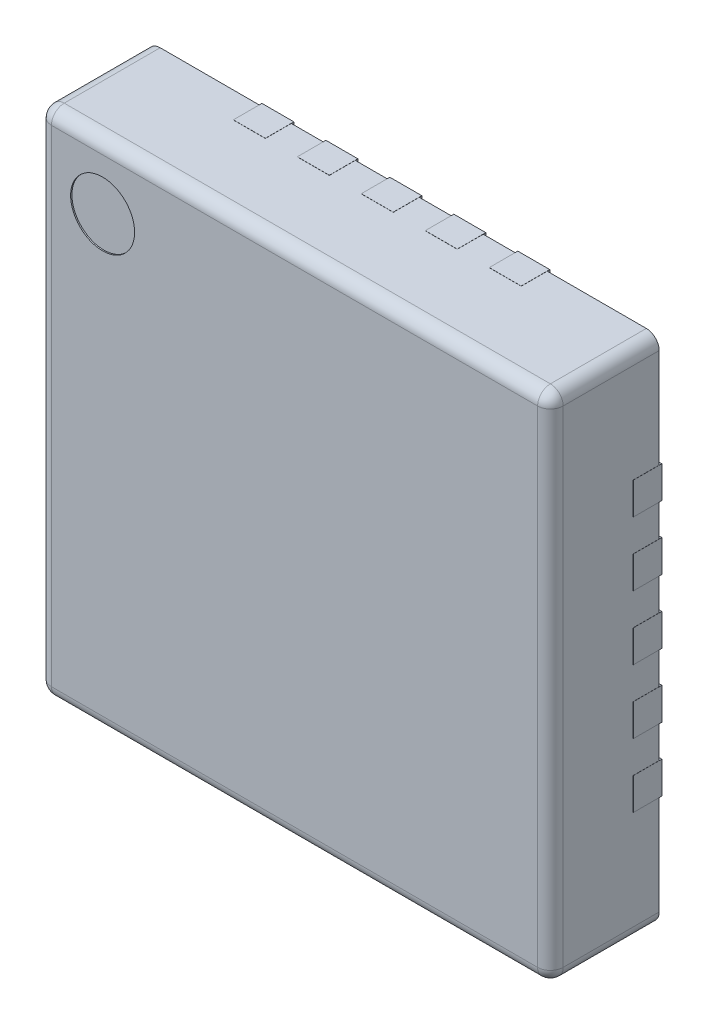
from build123d import *

# Parameters (mm, degrees)
SKETCH1_W                   = 4
SKETCH1_H                   = 4
BOSS_EXTRUDE1_DEPTH         = 0.85
FILLET1_R                   = 0.1
BOSS_EXTRUDE2_DEPTH         = 0.02
BOSS_EXTRUDE2_DEPTH_BACK    = 0.203
BOSS_EXTRUDE2_2_DEPTH       = 0.02
BOSS_EXTRUDE2_2_DEPTH_BACK  = 0.203
BOSS_EXTRUDE2_3_DEPTH       = 0.02
BOSS_EXTRUDE2_3_DEPTH_BACK  = 0.203
BOSS_EXTRUDE2_4_DEPTH       = 0.02
BOSS_EXTRUDE2_4_DEPTH_BACK  = 0.203
BOSS_EXTRUDE2_5_DEPTH       = 0.02
BOSS_EXTRUDE2_5_DEPTH_BACK  = 0.203
BOSS_EXTRUDE2_6_DEPTH       = 0.02
BOSS_EXTRUDE2_6_DEPTH_BACK  = 0.203
BOSS_EXTRUDE2_7_DEPTH       = 0.02
BOSS_EXTRUDE2_7_DEPTH_BACK  = 0.203
BOSS_EXTRUDE2_8_DEPTH       = 0.02
BOSS_EXTRUDE2_8_DEPTH_BACK  = 0.203
BOSS_EXTRUDE2_9_DEPTH       = 0.02
BOSS_EXTRUDE2_9_DEPTH_BACK  = 0.203
BOSS_EXTRUDE2_10_DEPTH      = 0.02
BOSS_EXTRUDE2_10_DEPTH_BACK = 0.203
BOSS_EXTRUDE2_11_DEPTH      = 0.02
BOSS_EXTRUDE2_11_DEPTH_BACK = 0.203
BOSS_EXTRUDE2_12_DEPTH      = 0.02
BOSS_EXTRUDE2_12_DEPTH_BACK = 0.203
BOSS_EXTRUDE2_13_DEPTH      = 0.02
BOSS_EXTRUDE2_13_DEPTH_BACK = 0.203
BOSS_EXTRUDE2_14_DEPTH      = 0.02
BOSS_EXTRUDE2_14_DEPTH_BACK = 0.203
BOSS_EXTRUDE2_15_DEPTH      = 0.02
BOSS_EXTRUDE2_15_DEPTH_BACK = 0.203
BOSS_EXTRUDE2_16_DEPTH      = 0.02
BOSS_EXTRUDE2_16_DEPTH_BACK = 0.203
BOSS_EXTRUDE2_17_DEPTH      = 0.02
BOSS_EXTRUDE2_17_DEPTH_BACK = 0.203
BOSS_EXTRUDE2_18_DEPTH      = 0.02
BOSS_EXTRUDE2_18_DEPTH_BACK = 0.203
BOSS_EXTRUDE2_19_DEPTH      = 0.02
BOSS_EXTRUDE2_19_DEPTH_BACK = 0.203
BOSS_EXTRUDE2_20_DEPTH      = 0.02
BOSS_EXTRUDE2_20_DEPTH_BACK = 0.203
BOSS_EXTRUDE2_21_DEPTH      = 0.02
BOSS_EXTRUDE2_21_DEPTH_BACK = 0.203
SKETCH3_R                   = 0.25
CUT_EXTRUDE1_DEPTH          = 0.01


with BuildPart() as part:
    # Sketch1 → Boss-Extrude1 (new body)
    with BuildSketch(Plane.XY):
        Rectangle(SKETCH1_W, SKETCH1_H)
    extrude(amount=BOSS_EXTRUDE1_DEPTH)

    # Fillet1
    fillet1_edges = [part.edges().sort_by_distance(p)[0] for p in [
        (-2, -2, 0.425),
        (-2, 0, 0.85),
        (0, -2, 0.85),
        (2, -2, 0.425),
        (2, 0, 0.85),
        (0, 2, 0.85),
        (-2, 2, 0.425),
        (2, 2, 0.425),
    ]]
    fillet(fillet1_edges, radius=FILLET1_R)

    # Sketch3 → Cut-Extrude1 (cut)
    with BuildSketch(Plane.XY.offset(0.85)):
        with Locations((-1.5, 1.5)):
            Circle(SKETCH3_R)
    extrude(amount=-CUT_EXTRUDE1_DEPTH, mode=Mode.SUBTRACT)


with BuildPart() as body_2:
    # Sketch2 → Boss-Extrude2 (new, two sides: drawn at the far end of the back side and taken through both)
    with BuildSketch(Plane(origin=(0, 0, 0), x_dir=(-1, 0, 0), z_dir=(0, 0, -1)).offset(-BOSS_EXTRUDE2_DEPTH_BACK)):
        with BuildLine():
            Line((1.263388348, 1.036611652), (1.036611652, 1.263388348))
            ThreePointArc((1.036611652, 1.263388348), (0.996058734, 1.290484942), (0.948223305, 1.3))
            Line((0.948223305, 1.3), (-1.175, 1.3))
            ThreePointArc((-1.175, 1.3), (-1.263388348, 1.263388348), (-1.3, 1.175))
            Line((-1.3, 1.175), (-1.3, -1.175))
            ThreePointArc((-1.3, -1.175), (-1.263388348, -1.263388348), (-1.175, -1.3))
            Line((-1.175, -1.3), (1.175, -1.3))
            ThreePointArc((1.175, -1.3), (1.263388348, -1.263388348), (1.3, -1.175))
            Line((1.3, -1.175), (1.3, 0.948223305))
            ThreePointArc((1.3, 0.948223305), (1.290484942, 0.996058734), (1.263388348, 1.036611652))
        make_face()
    extrude(amount=BOSS_EXTRUDE2_DEPTH + BOSS_EXTRUDE2_DEPTH_BACK)


with BuildPart() as body_3:
    # Sketch2 → Boss-Extrude2 2 (new, two sides: drawn at the far end of the back side and taken through both)
    with BuildSketch(Plane(origin=(0, 0, 0), x_dir=(-1, 0, 0), z_dir=(0, 0, -1)).offset(-BOSS_EXTRUDE2_2_DEPTH_BACK)):
        with BuildLine():
            Line((-0.125, 2.001), (0.125, 2.001))
            Line((0.125, 2.001), (0.125, 1.726))
            ThreePointArc((0.125, 1.726), (0, 1.601), (-0.125, 1.726))
            Line((-0.125, 1.726), (-0.125, 2.001))
        make_face()
    extrude(amount=BOSS_EXTRUDE2_2_DEPTH + BOSS_EXTRUDE2_2_DEPTH_BACK)


with BuildPart() as body_4:
    # Sketch2 → Boss-Extrude2 3 (new, two sides: drawn at the far end of the back side and taken through both)
    with BuildSketch(Plane(origin=(0, 0, 0), x_dir=(-1, 0, 0), z_dir=(0, 0, -1)).offset(-BOSS_EXTRUDE2_3_DEPTH_BACK)):
        with BuildLine():
            Line((-0.375, 2.001), (-0.375, 1.726))
            ThreePointArc((-0.375, 1.726), (-0.5, 1.601), (-0.625, 1.726))
            Line((-0.625, 1.726), (-0.625, 2.001))
            Line((-0.625, 2.001), (-0.375, 2.001))
        make_face()
    extrude(amount=BOSS_EXTRUDE2_3_DEPTH + BOSS_EXTRUDE2_3_DEPTH_BACK)


with BuildPart() as body_5:
    # Sketch2 → Boss-Extrude2 4 (new, two sides: drawn at the far end of the back side and taken through both)
    with BuildSketch(Plane(origin=(0, 0, 0), x_dir=(-1, 0, 0), z_dir=(0, 0, -1)).offset(-BOSS_EXTRUDE2_4_DEPTH_BACK)):
        with BuildLine():
            Line((-0.875, 2.001), (-0.875, 1.726))
            ThreePointArc((-0.875, 1.726), (-1, 1.601), (-1.125, 1.726))
            Line((-1.125, 1.726), (-1.125, 2.001))
            Line((-1.125, 2.001), (-0.875, 2.001))
        make_face()
    extrude(amount=BOSS_EXTRUDE2_4_DEPTH + BOSS_EXTRUDE2_4_DEPTH_BACK)


with BuildPart() as body_6:
    # Sketch2 → Boss-Extrude2 5 (new, two sides: drawn at the far end of the back side and taken through both)
    with BuildSketch(Plane(origin=(0, 0, 0), x_dir=(-1, 0, 0), z_dir=(0, 0, -1)).offset(-BOSS_EXTRUDE2_5_DEPTH_BACK)):
        with BuildLine():
            Line((1.125, 2.001), (0.875, 2.001))
            Line((0.875, 2.001), (0.875, 1.726))
            ThreePointArc((0.875, 1.726), (1, 1.601), (1.125, 1.726))
            Line((1.125, 1.726), (1.125, 2.001))
        make_face()
    extrude(amount=BOSS_EXTRUDE2_5_DEPTH + BOSS_EXTRUDE2_5_DEPTH_BACK)


with BuildPart() as body_7:
    # Sketch2 → Boss-Extrude2 6 (new, two sides: drawn at the far end of the back side and taken through both)
    with BuildSketch(Plane(origin=(0, 0, 0), x_dir=(-1, 0, 0), z_dir=(0, 0, -1)).offset(-BOSS_EXTRUDE2_6_DEPTH_BACK)):
        with BuildLine():
            Line((0.625, 2.001), (0.375, 2.001))
            Line((0.375, 2.001), (0.375, 1.726))
            ThreePointArc((0.375, 1.726), (0.5, 1.601), (0.625, 1.726))
            Line((0.625, 1.726), (0.625, 2.001))
        make_face()
    extrude(amount=BOSS_EXTRUDE2_6_DEPTH + BOSS_EXTRUDE2_6_DEPTH_BACK)


with BuildPart() as body_8:
    # Sketch2 → Boss-Extrude2 7 (new, two sides: drawn at the far end of the back side and taken through both)
    with BuildSketch(Plane(origin=(0, 0, 0), x_dir=(-1, 0, 0), z_dir=(0, 0, -1)).offset(-BOSS_EXTRUDE2_7_DEPTH_BACK)):
        with BuildLine():
            Line((1.125, -2.001), (1.125, -1.726))
            ThreePointArc((1.125, -1.726), (1, -1.601), (0.875, -1.726))
            Line((0.875, -1.726), (0.875, -2.001))
            Line((0.875, -2.001), (1.125, -2.001))
        make_face()
    extrude(amount=BOSS_EXTRUDE2_7_DEPTH + BOSS_EXTRUDE2_7_DEPTH_BACK)


with BuildPart() as body_9:
    # Sketch2 → Boss-Extrude2 8 (new, two sides: drawn at the far end of the back side and taken through both)
    with BuildSketch(Plane(origin=(0, 0, 0), x_dir=(-1, 0, 0), z_dir=(0, 0, -1)).offset(-BOSS_EXTRUDE2_8_DEPTH_BACK)):
        with BuildLine():
            Line((0.625, -2.001), (0.625, -1.726))
            ThreePointArc((0.625, -1.726), (0.5, -1.601), (0.375, -1.726))
            Line((0.375, -1.726), (0.375, -2.001))
            Line((0.375, -2.001), (0.625, -2.001))
        make_face()
    extrude(amount=BOSS_EXTRUDE2_8_DEPTH + BOSS_EXTRUDE2_8_DEPTH_BACK)


with BuildPart() as body_10:
    # Sketch2 → Boss-Extrude2 9 (new, two sides: drawn at the far end of the back side and taken through both)
    with BuildSketch(Plane(origin=(0, 0, 0), x_dir=(-1, 0, 0), z_dir=(0, 0, -1)).offset(-BOSS_EXTRUDE2_9_DEPTH_BACK)):
        with BuildLine():
            Line((-0.125, -2.001), (0.125, -2.001))
            Line((0.125, -2.001), (0.125, -1.726))
            ThreePointArc((0.125, -1.726), (0, -1.601), (-0.125, -1.726))
            Line((-0.125, -1.726), (-0.125, -2.001))
        make_face()
    extrude(amount=BOSS_EXTRUDE2_9_DEPTH + BOSS_EXTRUDE2_9_DEPTH_BACK)


with BuildPart() as body_11:
    # Sketch2 → Boss-Extrude2 10 (new, two sides: drawn at the far end of the back side and taken through both)
    with BuildSketch(Plane(origin=(0, 0, 0), x_dir=(-1, 0, 0), z_dir=(0, 0, -1)).offset(-BOSS_EXTRUDE2_10_DEPTH_BACK)):
        with BuildLine():
            Line((-0.625, -2.001), (-0.375, -2.001))
            Line((-0.375, -2.001), (-0.375, -1.726))
            ThreePointArc((-0.375, -1.726), (-0.5, -1.601), (-0.625, -1.726))
            Line((-0.625, -1.726), (-0.625, -2.001))
        make_face()
    extrude(amount=BOSS_EXTRUDE2_10_DEPTH + BOSS_EXTRUDE2_10_DEPTH_BACK)


with BuildPart() as body_12:
    # Sketch2 → Boss-Extrude2 11 (new, two sides: drawn at the far end of the back side and taken through both)
    with BuildSketch(Plane(origin=(0, 0, 0), x_dir=(-1, 0, 0), z_dir=(0, 0, -1)).offset(-BOSS_EXTRUDE2_11_DEPTH_BACK)):
        with BuildLine():
            Line((-1.125, -2.001), (-0.875, -2.001))
            Line((-0.875, -2.001), (-0.875, -1.726))
            ThreePointArc((-0.875, -1.726), (-1, -1.601), (-1.125, -1.726))
            Line((-1.125, -1.726), (-1.125, -2.001))
        make_face()
    extrude(amount=BOSS_EXTRUDE2_11_DEPTH + BOSS_EXTRUDE2_11_DEPTH_BACK)


with BuildPart() as body_13:
    # Sketch2 → Boss-Extrude2 12 (new, two sides: drawn at the far end of the back side and taken through both)
    with BuildSketch(Plane(origin=(0, 0, 0), x_dir=(-1, 0, 0), z_dir=(0, 0, -1)).offset(-BOSS_EXTRUDE2_12_DEPTH_BACK)):
        with BuildLine():
            Line((2.001, -1.125), (2.001, -0.875))
            Line((2.001, -0.875), (1.726, -0.875))
            ThreePointArc((1.726, -0.875), (1.601, -1), (1.726, -1.125))
            Line((1.726, -1.125), (2.001, -1.125))
        make_face()
    extrude(amount=BOSS_EXTRUDE2_12_DEPTH + BOSS_EXTRUDE2_12_DEPTH_BACK)


with BuildPart() as body_14:
    # Sketch2 → Boss-Extrude2 13 (new, two sides: drawn at the far end of the back side and taken through both)
    with BuildSketch(Plane(origin=(0, 0, 0), x_dir=(-1, 0, 0), z_dir=(0, 0, -1)).offset(-BOSS_EXTRUDE2_13_DEPTH_BACK)):
        with BuildLine():
            Line((2.001, -0.625), (2.001, -0.375))
            Line((2.001, -0.375), (1.726, -0.375))
            ThreePointArc((1.726, -0.375), (1.601, -0.5), (1.726, -0.625))
            Line((1.726, -0.625), (2.001, -0.625))
        make_face()
    extrude(amount=BOSS_EXTRUDE2_13_DEPTH + BOSS_EXTRUDE2_13_DEPTH_BACK)


with BuildPart() as body_15:
    # Sketch2 → Boss-Extrude2 14 (new, two sides: drawn at the far end of the back side and taken through both)
    with BuildSketch(Plane(origin=(0, 0, 0), x_dir=(-1, 0, 0), z_dir=(0, 0, -1)).offset(-BOSS_EXTRUDE2_14_DEPTH_BACK)):
        with BuildLine():
            Line((2.001, 0.125), (1.726, 0.125))
            ThreePointArc((1.726, 0.125), (1.601, 0), (1.726, -0.125))
            Line((1.726, -0.125), (2.001, -0.125))
            Line((2.001, -0.125), (2.001, 0.125))
        make_face()
    extrude(amount=BOSS_EXTRUDE2_14_DEPTH + BOSS_EXTRUDE2_14_DEPTH_BACK)


with BuildPart() as body_16:
    # Sketch2 → Boss-Extrude2 15 (new, two sides: drawn at the far end of the back side and taken through both)
    with BuildSketch(Plane(origin=(0, 0, 0), x_dir=(-1, 0, 0), z_dir=(0, 0, -1)).offset(-BOSS_EXTRUDE2_15_DEPTH_BACK)):
        with BuildLine():
            Line((2.001, 0.625), (1.726, 0.625))
            ThreePointArc((1.726, 0.625), (1.601, 0.5), (1.726, 0.375))
            Line((1.726, 0.375), (2.001, 0.375))
            Line((2.001, 0.375), (2.001, 0.625))
        make_face()
    extrude(amount=BOSS_EXTRUDE2_15_DEPTH + BOSS_EXTRUDE2_15_DEPTH_BACK)


with BuildPart() as body_17:
    # Sketch2 → Boss-Extrude2 16 (new, two sides: drawn at the far end of the back side and taken through both)
    with BuildSketch(Plane(origin=(0, 0, 0), x_dir=(-1, 0, 0), z_dir=(0, 0, -1)).offset(-BOSS_EXTRUDE2_16_DEPTH_BACK)):
        with BuildLine():
            Line((2.001, 1.125), (1.726, 1.125))
            ThreePointArc((1.726, 1.125), (1.601, 1), (1.726, 0.875))
            Line((1.726, 0.875), (2.001, 0.875))
            Line((2.001, 0.875), (2.001, 1.125))
        make_face()
    extrude(amount=BOSS_EXTRUDE2_16_DEPTH + BOSS_EXTRUDE2_16_DEPTH_BACK)


with BuildPart() as body_18:
    # Sketch2 → Boss-Extrude2 17 (new, two sides: drawn at the far end of the back side and taken through both)
    with BuildSketch(Plane(origin=(0, 0, 0), x_dir=(-1, 0, 0), z_dir=(0, 0, -1)).offset(-BOSS_EXTRUDE2_17_DEPTH_BACK)):
        with BuildLine():
            Line((-2.001, -1.125), (-1.726, -1.125))
            ThreePointArc((-1.726, -1.125), (-1.601, -1), (-1.726, -0.875))
            Line((-1.726, -0.875), (-2.001, -0.875))
            Line((-2.001, -0.875), (-2.001, -1.125))
        make_face()
    extrude(amount=BOSS_EXTRUDE2_17_DEPTH + BOSS_EXTRUDE2_17_DEPTH_BACK)


with BuildPart() as body_19:
    # Sketch2 → Boss-Extrude2 18 (new, two sides: drawn at the far end of the back side and taken through both)
    with BuildSketch(Plane(origin=(0, 0, 0), x_dir=(-1, 0, 0), z_dir=(0, 0, -1)).offset(-BOSS_EXTRUDE2_18_DEPTH_BACK)):
        with BuildLine():
            Line((-2.001, -0.625), (-1.726, -0.625))
            ThreePointArc((-1.726, -0.625), (-1.601, -0.5), (-1.726, -0.375))
            Line((-1.726, -0.375), (-2.001, -0.375))
            Line((-2.001, -0.375), (-2.001, -0.625))
        make_face()
    extrude(amount=BOSS_EXTRUDE2_18_DEPTH + BOSS_EXTRUDE2_18_DEPTH_BACK)


with BuildPart() as body_20:
    # Sketch2 → Boss-Extrude2 19 (new, two sides: drawn at the far end of the back side and taken through both)
    with BuildSketch(Plane(origin=(0, 0, 0), x_dir=(-1, 0, 0), z_dir=(0, 0, -1)).offset(-BOSS_EXTRUDE2_19_DEPTH_BACK)):
        with BuildLine():
            Line((-2.001, 0.125), (-2.001, -0.125))
            Line((-2.001, -0.125), (-1.726, -0.125))
            ThreePointArc((-1.726, -0.125), (-1.601, 0), (-1.726, 0.125))
            Line((-1.726, 0.125), (-2.001, 0.125))
        make_face()
    extrude(amount=BOSS_EXTRUDE2_19_DEPTH + BOSS_EXTRUDE2_19_DEPTH_BACK)


with BuildPart() as body_21:
    # Sketch2 → Boss-Extrude2 20 (new, two sides: drawn at the far end of the back side and taken through both)
    with BuildSketch(Plane(origin=(0, 0, 0), x_dir=(-1, 0, 0), z_dir=(0, 0, -1)).offset(-BOSS_EXTRUDE2_20_DEPTH_BACK)):
        with BuildLine():
            Line((-2.001, 0.625), (-2.001, 0.375))
            Line((-2.001, 0.375), (-1.726, 0.375))
            ThreePointArc((-1.726, 0.375), (-1.601, 0.5), (-1.726, 0.625))
            Line((-1.726, 0.625), (-2.001, 0.625))
        make_face()
    extrude(amount=BOSS_EXTRUDE2_20_DEPTH + BOSS_EXTRUDE2_20_DEPTH_BACK)


with BuildPart() as body_22:
    # Sketch2 → Boss-Extrude2 21 (new, two sides: drawn at the far end of the back side and taken through both)
    with BuildSketch(Plane(origin=(0, 0, 0), x_dir=(-1, 0, 0), z_dir=(0, 0, -1)).offset(-BOSS_EXTRUDE2_21_DEPTH_BACK)):
        with BuildLine():
            Line((-2.001, 1.125), (-2.001, 0.875))
            Line((-2.001, 0.875), (-1.726, 0.875))
            ThreePointArc((-1.726, 0.875), (-1.601, 1), (-1.726, 1.125))
            Line((-1.726, 1.125), (-2.001, 1.125))
        make_face()
    extrude(amount=BOSS_EXTRUDE2_21_DEPTH + BOSS_EXTRUDE2_21_DEPTH_BACK)


solid = Compound([part.part, body_2.part, body_3.part, body_4.part, body_5.part, body_6.part, body_7.part, body_8.part, body_9.part, body_10.part, body_11.part, body_12.part, body_13.part, body_14.part, body_15.part, body_16.part, body_17.part, body_18.part, body_19.part, body_20.part, body_21.part, body_22.part])
